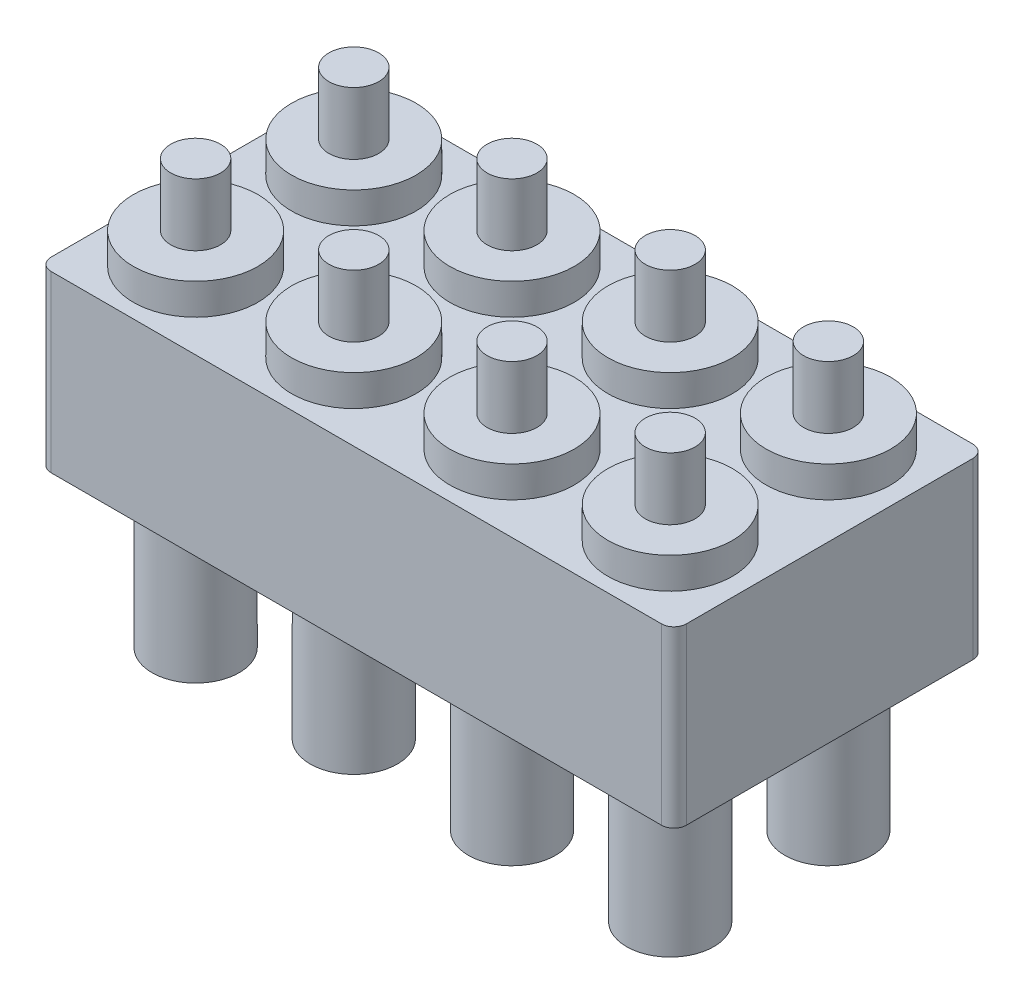
from build123d import *

# Parameters (mm, degrees)
SKETCH_1_W          = 10.2
SKETCH_1_H          = 5
EXTRUDE_1_DEPTH     = 2.8
SKETCH_2_R          = 1
EXTRUDE_2_DEPTH     = 0.5
SKETCH_3_R          = 0.4
EXTRUDE_3_DEPTH     = 1
SKETCH_4_R          = 0.7
EXTRUDE_4_DEPTH     = 5.8
SKETCH_5_R          = 0.6
CUT_EXTRUDE_1_DEPTH = 0.25
FILLET_1_R          = 0.6
FILLET_2_R          = 0.2


with BuildPart() as part:
    # 草图1 → 凸台-拉伸1 (new body)
    with BuildSketch(Plane(origin=(0, 0, 0), x_dir=(1, 0, 0), z_dir=(0, 1, 0))):
        with Locations((5.1, 2.5)):
            Rectangle(SKETCH_1_W, SKETCH_1_H)
    extrude(amount=EXTRUDE_1_DEPTH)

    # 草图2 → 凸台-拉伸2 (add)
    with BuildSketch(Plane(origin=(0, 2.8, 0), x_dir=(1, 0, 0), z_dir=(0, 1, 0))):
        with Locations(Location((1.29, 3.77, 0), (0, 0, 90))):
            Circle(SKETCH_2_R)
        with Locations(Location((3.83, 3.77, 0), (0, 0, 90))):
            Circle(SKETCH_2_R)
        with Locations(Location((6.37, 3.77, 0), (0, 0, 90))):
            Circle(SKETCH_2_R)
        with Locations(Location((8.91, 3.77, 0), (0, 0, 90))):
            Circle(SKETCH_2_R)
        with Locations(Location((3.83, 1.23, 0), (0, 0, 90))):
            Circle(SKETCH_2_R)
        with Locations(Location((6.37, 1.23, 0), (0, 0, 90))):
            Circle(SKETCH_2_R)
        with Locations(Location((8.91, 1.23, 0), (0, 0, 90))):
            Circle(SKETCH_2_R)
        with Locations(Location((1.29, 1.23, 0), (0, 0, 90))):
            Circle(SKETCH_2_R)
    extrude(amount=EXTRUDE_2_DEPTH)

    # 草图3 → 凸台-拉伸3 (add)
    with BuildSketch(Plane(origin=(0, 3.3, 0), x_dir=(1, 0, 0), z_dir=(0, 1, 0))):
        with Locations(Location((1.29, 1.23, 0), (0, 0, 270))):
            Circle(SKETCH_3_R)
        with Locations(Location((3.83, 1.23, 0), (0, 0, 270))):
            Circle(SKETCH_3_R)
        with Locations(Location((6.37, 1.23, 0), (0, 0, 270))):
            Circle(SKETCH_3_R)
        with Locations(Location((8.91, 1.23, 0), (0, 0, 270))):
            Circle(SKETCH_3_R)
        with Locations(Location((3.83, 3.77, 0), (0, 0, 270))):
            Circle(SKETCH_3_R)
        with Locations(Location((6.37, 3.77, 0), (0, 0, 270))):
            Circle(SKETCH_3_R)
        with Locations(Location((8.91, 3.77, 0), (0, 0, 270))):
            Circle(SKETCH_3_R)
        with Locations(Location((1.29, 3.77, 0), (0, 0, 270))):
            Circle(SKETCH_3_R)
    extrude(amount=EXTRUDE_3_DEPTH)

    # 草图4 → 凸台-拉伸4 (add)
    with BuildSketch(Plane(origin=(0, 3.3, 0), x_dir=(1, 0, 0), z_dir=(0, 1, 0))):
        with Locations(Location((1.29, 1.23, 0), (0, 0, 270))):
            Circle(SKETCH_4_R)
        with Locations(Location((3.83, 1.23, 0), (0, 0, 270))):
            Circle(SKETCH_4_R)
        with Locations(Location((6.37, 1.23, 0), (0, 0, 270))):
            Circle(SKETCH_4_R)
        with Locations(Location((8.91, 1.23, 0), (0, 0, 270))):
            Circle(SKETCH_4_R)
        with Locations(Location((3.83, 3.77, 0), (0, 0, 270))):
            Circle(SKETCH_4_R)
        with Locations(Location((6.37, 3.77, 0), (0, 0, 270))):
            Circle(SKETCH_4_R)
        with Locations(Location((8.91, 3.77, 0), (0, 0, 270))):
            Circle(SKETCH_4_R)
        with Locations(Location((1.29, 3.77, 0), (0, 0, 270))):
            Circle(SKETCH_4_R)
    extrude(amount=-EXTRUDE_4_DEPTH)

    # 草图5 → 切除-拉伸1 (cut)
    with BuildSketch(Plane.XZ.offset(2.5)):
        with Locations(Location((8.91, -1.23, 0), (0, 0, 270))):
            Circle(SKETCH_5_R)
        with Locations(Location((6.37, -1.23, 0), (0, 0, 270))):
            Circle(SKETCH_5_R)
        with Locations(Location((3.83, -1.23, 0), (0, 0, 270))):
            Circle(SKETCH_5_R)
        with Locations(Location((1.29, -1.23, 0), (0, 0, 270))):
            Circle(SKETCH_5_R)
        with Locations(Location((6.37, -3.77, 0), (0, 0, 270))):
            Circle(SKETCH_5_R)
        with Locations(Location((3.83, -3.77, 0), (0, 0, 270))):
            Circle(SKETCH_5_R)
        with Locations(Location((1.29, -3.77, 0), (0, 0, 270))):
            Circle(SKETCH_5_R)
        with Locations(Location((8.91, -3.77, 0), (0, 0, 270))):
            Circle(SKETCH_5_R)
    extrude(amount=-CUT_EXTRUDE_1_DEPTH, mode=Mode.SUBTRACT)

    # 圆角1
    # the kernel refuses this fillet: 0.6 mm, written as the material it adds along each edge
    with BuildSketch(Plane(origin=(6.37, -2.25, -3.77), x_dir=(0, 0, -1), z_dir=(-1, 0, 0))) as fillet_1_piece_1:
        with BuildLine():
            CenterArc((0.112660283, 0.6), FILLET_1_R, 270, 54.314665288)
            Line((0.112660283, 0), (0.112660283, -0.012))
            Line((0.112660283, -0.012), (0.6, -0.012))
            Line((0.6, -0.012), (0.612, 0))
            ThreePointArc((0.612, 0), (0.612, 0.125), (0.609746794, 0.243))
            Line((0.609746794, 0.243), (0.6, 0.25))
        make_face()
    revolve(axis=Axis((6.37, -2.25, -3.77), (0, -1, 0)))
    with BuildSketch(Plane(origin=(1.29, -2.25, -1.23), x_dir=(0, 0, -1), z_dir=(-1, 0, 0))) as fillet_1_piece_2:
        with BuildLine():
            CenterArc((0.112660283, 0.6), FILLET_1_R, 270, 54.314665288)
            Line((0.112660283, 0), (0.112660283, -0.012))
            Line((0.112660283, -0.012), (0.6, -0.012))
            Line((0.6, -0.012), (0.612, 0))
            ThreePointArc((0.612, 0), (0.612, 0.125), (0.609746794, 0.243))
            Line((0.609746794, 0.243), (0.6, 0.25))
        make_face()
    revolve(axis=Axis((1.29, -2.25, -1.23), (0, -1, 0)))
    with BuildSketch(Plane(origin=(3.83, -2.25, -1.23), x_dir=(0, 0, -1), z_dir=(-1, 0, 0))) as fillet_1_piece_3:
        with BuildLine():
            CenterArc((0.112660283, 0.6), FILLET_1_R, 270, 54.314665288)
            Line((0.112660283, 0), (0.112660283, -0.012))
            Line((0.112660283, -0.012), (0.6, -0.012))
            Line((0.6, -0.012), (0.612, 0))
            ThreePointArc((0.612, 0), (0.612, 0.125), (0.609746794, 0.243))
            Line((0.609746794, 0.243), (0.6, 0.25))
        make_face()
    revolve(axis=Axis((3.83, -2.25, -1.23), (0, -1, 0)))
    with BuildSketch(Plane(origin=(6.37, -2.25, -1.23), x_dir=(0, 0, -1), z_dir=(-1, 0, 0))) as fillet_1_piece_4:
        with BuildLine():
            CenterArc((0.112660283, 0.6), FILLET_1_R, 270, 54.314665288)
            Line((0.112660283, 0), (0.112660283, -0.012))
            Line((0.112660283, -0.012), (0.6, -0.012))
            Line((0.6, -0.012), (0.612, 0))
            ThreePointArc((0.612, 0), (0.612, 0.125), (0.609746794, 0.243))
            Line((0.609746794, 0.243), (0.6, 0.25))
        make_face()
    revolve(axis=Axis((6.37, -2.25, -1.23), (0, -1, 0)))
    with BuildSketch(Plane(origin=(3.83, -2.25, -3.77), x_dir=(0, 0, -1), z_dir=(-1, 0, 0))) as fillet_1_piece_5:
        with BuildLine():
            CenterArc((0.112660283, 0.6), FILLET_1_R, 270, 54.314665288)
            Line((0.112660283, 0), (0.112660283, -0.012))
            Line((0.112660283, -0.012), (0.6, -0.012))
            Line((0.6, -0.012), (0.612, 0))
            ThreePointArc((0.612, 0), (0.612, 0.125), (0.609746794, 0.243))
            Line((0.609746794, 0.243), (0.6, 0.25))
        make_face()
    revolve(axis=Axis((3.83, -2.25, -3.77), (0, -1, 0)))
    with BuildSketch(Plane(origin=(1.29, -2.25, -3.77), x_dir=(0, 0, -1), z_dir=(-1, 0, 0))) as fillet_1_piece_6:
        with BuildLine():
            CenterArc((0.112660283, 0.6), FILLET_1_R, 270, 54.314665288)
            Line((0.112660283, 0), (0.112660283, -0.012))
            Line((0.112660283, -0.012), (0.6, -0.012))
            Line((0.6, -0.012), (0.612, 0))
            ThreePointArc((0.612, 0), (0.612, 0.125), (0.609746794, 0.243))
            Line((0.609746794, 0.243), (0.6, 0.25))
        make_face()
    revolve(axis=Axis((1.29, -2.25, -3.77), (0, -1, 0)))
    with BuildSketch(Plane(origin=(8.91, -2.25, -3.77), x_dir=(0, 0, -1), z_dir=(-1, 0, 0))) as fillet_1_piece_7:
        with BuildLine():
            CenterArc((0.112660283, 0.6), FILLET_1_R, 270, 54.314665288)
            Line((0.112660283, 0), (0.112660283, -0.012))
            Line((0.112660283, -0.012), (0.6, -0.012))
            Line((0.6, -0.012), (0.612, 0))
            ThreePointArc((0.612, 0), (0.612, 0.125), (0.609746794, 0.243))
            Line((0.609746794, 0.243), (0.6, 0.25))
        make_face()
    revolve(axis=Axis((8.91, -2.25, -3.77), (0, -1, 0)))
    with BuildSketch(Plane(origin=(8.91, -2.25, -1.23), x_dir=(0, 0, -1), z_dir=(-1, 0, 0))) as fillet_1_piece_8:
        with BuildLine():
            CenterArc((0.112660283, 0.6), FILLET_1_R, 270, 54.314665288)
            Line((0.112660283, 0), (0.112660283, -0.012))
            Line((0.112660283, -0.012), (0.6, -0.012))
            Line((0.6, -0.012), (0.612, 0))
            ThreePointArc((0.612, 0), (0.612, 0.125), (0.609746794, 0.243))
            Line((0.609746794, 0.243), (0.6, 0.25))
        make_face()
    revolve(axis=Axis((8.91, -2.25, -1.23), (0, -1, 0)))

    # 圆角2
    fillet_2_edges = [part.edges().sort_by_distance(p)[0] for p in [
        (0, 1.4, -5),
        (10.2, 1.4, -5),
        (10.2, 1.4, 0),
        (0, 1.4, 0),
    ]]
    fillet(fillet_2_edges, radius=FILLET_2_R)


solid = part.part
